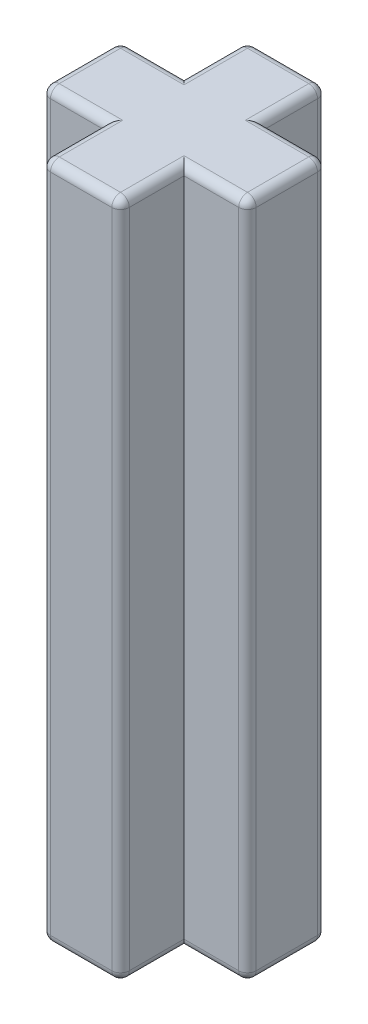
from build123d import *

# Parameters (mm, degrees)
BOSS_EXTRUDE1_DEPTH = 15.5
FILLET1_R           = 0.2
FILLET2_R           = 0.2
FILLET3_R           = 0.2


with BuildPart() as part:
    # Sketch1 → Boss-Extrude1 (new body)
    with BuildSketch(Plane(origin=(0, 0, 0), x_dir=(1, 0, 0), z_dir=(0, 1, 0))):
        Polygon((-0.9, 0.9), (-0.9, 2.35), (0.9, 2.35), (0.9, 0.9), (2.35, 0.9), (2.35, -0.9), (0.9, -0.9), (0.9, -2.35), (-0.9, -2.35), (-0.9, -0.9), (-2.35, -0.9), (-2.35, 0.9), align=None)
    extrude(amount=BOSS_EXTRUDE1_DEPTH)

    # Fillet1
    fillet1_edges = [part.edges().sort_by_distance(p)[0] for p in [
        (-0.9, 15.5, -1.625),
        (-1.625, 15.5, -0.9),
        (-2.35, 15.5, 0),
        (-1.625, 15.5, 0.9),
        (-0.9, 15.5, 1.625),
        (0, 15.5, 2.35),
        (0.9, 15.5, 1.625),
        (1.625, 15.5, 0.9),
        (2.35, 15.5, 0),
        (1.625, 15.5, -0.9),
        (0.9, 15.5, -1.625),
        (0, 15.5, -2.35),
    ]]
    fillet(fillet1_edges, radius=FILLET1_R)

    # Fillet2
    fillet2_edges = [part.edges().sort_by_distance(p)[0] for p in [
        (1.625, 0, -0.9),
        (2.35, 0, 0),
        (1.625, 0, 0.9),
        (0.9, 0, 1.625),
        (0, 0, 2.35),
        (-0.9, 0, 1.625),
        (-1.625, 0, 0.9),
        (-2.35, 0, 0),
        (-1.625, 0, -0.9),
        (-0.9, 0, -1.625),
        (0, 0, -2.35),
        (0.9, 0, -1.625),
    ]]
    fillet(fillet2_edges, radius=FILLET2_R)

    # Fillet3
    # the kernel refuses this fillet: 0.2 mm, written as the material it takes off along each edge
    with BuildSketch(Plane(origin=(-2.15, 15.3, 0.7), x_dir=(0, 0, 1), z_dir=(-1, 0, 0))) as fillet3_piece_1_section:
        Polygon((0, 0), (FILLET3_R, 0), (FILLET3_R, FILLET3_R), (0, FILLET3_R), align=None)
    fillet3_piece_1 = extrude(amount=FILLET3_R, mode=Mode.PRIVATE)
    fillet3_piece_1 = fillet3_piece_1 - Plane(origin=(-2.15, 15.3, 0.7), x_dir=(0, -0.7071067811865475, -0.7071067811865475), z_dir=(-1, 0, 0)) * Sphere(FILLET3_R, mode=Mode.PRIVATE)
    add(fillet3_piece_1, mode=Mode.SUBTRACT)
    with BuildSketch(Plane(origin=(-0.7, 15.3, 2.15), x_dir=(0, 0, 1), z_dir=(-1, 0, 0))) as fillet3_piece_2_section:
        Polygon((0, 0), (FILLET3_R, 0), (FILLET3_R, FILLET3_R), (0, FILLET3_R), align=None)
    fillet3_piece_2 = extrude(amount=FILLET3_R, mode=Mode.PRIVATE)
    fillet3_piece_2 = fillet3_piece_2 - Plane(origin=(-0.7, 15.3, 2.15), x_dir=(0, -0.7071067811865475, -0.7071067811865475), z_dir=(-1, 0, 0)) * Sphere(FILLET3_R, mode=Mode.PRIVATE)
    add(fillet3_piece_2, mode=Mode.SUBTRACT)
    with BuildSketch(Plane(origin=(-2.15, 15.3, -0.7), x_dir=(-1, 0, 0), z_dir=(0, 0, -1))) as fillet3_piece_3_section:
        Polygon((0, 0), (FILLET3_R, 0), (FILLET3_R, FILLET3_R), (0, FILLET3_R), align=None)
    fillet3_piece_3 = extrude(amount=FILLET3_R, mode=Mode.PRIVATE)
    fillet3_piece_3 = fillet3_piece_3 - Plane(origin=(-2.15, 15.3, -0.7), x_dir=(0.7071067811865475, -0.7071067811865475, 0), z_dir=(0, 0, -1)) * Sphere(FILLET3_R, mode=Mode.PRIVATE)
    add(fillet3_piece_3, mode=Mode.SUBTRACT)
    with BuildSketch(Plane(origin=(0.7, 15.3, 2.15), x_dir=(0, 0, 1), z_dir=(1, 0, 0))) as fillet3_piece_4_section:
        Polygon((0, 0), (FILLET3_R, 0), (FILLET3_R, -FILLET3_R), (0, -FILLET3_R), align=None)
    fillet3_piece_4 = extrude(amount=FILLET3_R, mode=Mode.PRIVATE)
    fillet3_piece_4 = fillet3_piece_4 - Plane(origin=(0.7, 15.3, 2.15), x_dir=(0, -0.7071067811865475, -0.7071067811865475), z_dir=(1, 0, 0)) * Sphere(FILLET3_R, mode=Mode.PRIVATE)
    add(fillet3_piece_4, mode=Mode.SUBTRACT)
    with BuildSketch(Plane(origin=(-0.7, 15.3, -2.15), x_dir=(0, 0, -1), z_dir=(-1, 0, 0))) as fillet3_piece_5_section:
        Polygon((0, 0), (FILLET3_R, 0), (FILLET3_R, -FILLET3_R), (0, -FILLET3_R), align=None)
    fillet3_piece_5 = extrude(amount=FILLET3_R, mode=Mode.PRIVATE)
    fillet3_piece_5 = fillet3_piece_5 - Plane(origin=(-0.7, 15.3, -2.15), x_dir=(0, -0.7071067811865475, 0.7071067811865475), z_dir=(-1, 0, 0)) * Sphere(FILLET3_R, mode=Mode.PRIVATE)
    add(fillet3_piece_5, mode=Mode.SUBTRACT)
    with BuildSketch(Plane(origin=(2.15, 15.3, 0.7), x_dir=(0, 0, 1), z_dir=(1, 0, 0))) as fillet3_piece_6_section:
        Polygon((0, 0), (FILLET3_R, 0), (FILLET3_R, -FILLET3_R), (0, -FILLET3_R), align=None)
    fillet3_piece_6 = extrude(amount=FILLET3_R, mode=Mode.PRIVATE)
    fillet3_piece_6 = fillet3_piece_6 - Plane(origin=(2.15, 15.3, 0.7), x_dir=(0, -0.7071067811865475, -0.7071067811865475), z_dir=(1, 0, 0)) * Sphere(FILLET3_R, mode=Mode.PRIVATE)
    add(fillet3_piece_6, mode=Mode.SUBTRACT)
    with BuildSketch(Plane(origin=(0.7, 15.3, -2.15), x_dir=(1, 0, 0), z_dir=(0, 0, -1))) as fillet3_piece_7_section:
        Polygon((0, 0), (FILLET3_R, 0), (FILLET3_R, -FILLET3_R), (0, -FILLET3_R), align=None)
    fillet3_piece_7 = extrude(amount=FILLET3_R, mode=Mode.PRIVATE)
    fillet3_piece_7 = fillet3_piece_7 - Plane(origin=(0.7, 15.3, -2.15), x_dir=(-0.7071067811865475, -0.7071067811865475, 0), z_dir=(0, 0, -1)) * Sphere(FILLET3_R, mode=Mode.PRIVATE)
    add(fillet3_piece_7, mode=Mode.SUBTRACT)
    with BuildSketch(Plane(origin=(2.15, 15.3, -0.7), x_dir=(1, 0, 0), z_dir=(0, 0, -1))) as fillet3_piece_8_section:
        Polygon((0, 0), (FILLET3_R, 0), (FILLET3_R, -FILLET3_R), (0, -FILLET3_R), align=None)
    fillet3_piece_8 = extrude(amount=FILLET3_R, mode=Mode.PRIVATE)
    fillet3_piece_8 = fillet3_piece_8 - Plane(origin=(2.15, 15.3, -0.7), x_dir=(-0.7071067811865475, -0.7071067811865475, 0), z_dir=(0, 0, -1)) * Sphere(FILLET3_R, mode=Mode.PRIVATE)
    add(fillet3_piece_8, mode=Mode.SUBTRACT)
    with BuildSketch(Plane(origin=(0.7, 0.2, 2.15), x_dir=(0, 0, 1), z_dir=(1, 0, 0))) as fillet3_piece_9_section:
        Polygon((0, 0), (FILLET3_R, 0), (FILLET3_R, FILLET3_R), (0, FILLET3_R), align=None)
    fillet3_piece_9 = extrude(amount=FILLET3_R, mode=Mode.PRIVATE)
    fillet3_piece_9 = fillet3_piece_9 - Plane(origin=(0.7, 0.2, 2.15), x_dir=(0, 0.7071067811865475, -0.7071067811865475), z_dir=(1, 0, 0)) * Sphere(FILLET3_R, mode=Mode.PRIVATE)
    add(fillet3_piece_9, mode=Mode.SUBTRACT)
    with BuildSketch(Plane(origin=(-0.7, 0.2, 2.15), x_dir=(0, 0, 1), z_dir=(-1, 0, 0))) as fillet3_piece_10_section:
        Polygon((0, 0), (FILLET3_R, 0), (FILLET3_R, -FILLET3_R), (0, -FILLET3_R), align=None)
    fillet3_piece_10 = extrude(amount=FILLET3_R, mode=Mode.PRIVATE)
    fillet3_piece_10 = fillet3_piece_10 - Plane(origin=(-0.7, 0.2, 2.15), x_dir=(0, 0.7071067811865475, -0.7071067811865475), z_dir=(-1, 0, 0)) * Sphere(FILLET3_R, mode=Mode.PRIVATE)
    add(fillet3_piece_10, mode=Mode.SUBTRACT)
    with BuildSketch(Plane(origin=(2.15, 0.2, 0.7), x_dir=(0, 0, 1), z_dir=(1, 0, 0))) as fillet3_piece_11_section:
        Polygon((0, 0), (FILLET3_R, 0), (FILLET3_R, FILLET3_R), (0, FILLET3_R), align=None)
    fillet3_piece_11 = extrude(amount=FILLET3_R, mode=Mode.PRIVATE)
    fillet3_piece_11 = fillet3_piece_11 - Plane(origin=(2.15, 0.2, 0.7), x_dir=(0, 0.7071067811865475, -0.7071067811865475), z_dir=(1, 0, 0)) * Sphere(FILLET3_R, mode=Mode.PRIVATE)
    add(fillet3_piece_11, mode=Mode.SUBTRACT)
    with BuildSketch(Plane(origin=(-2.15, 0.2, 0.7), x_dir=(0, 0, 1), z_dir=(-1, 0, 0))) as fillet3_piece_12_section:
        Polygon((0, 0), (FILLET3_R, 0), (FILLET3_R, -FILLET3_R), (0, -FILLET3_R), align=None)
    fillet3_piece_12 = extrude(amount=FILLET3_R, mode=Mode.PRIVATE)
    fillet3_piece_12 = fillet3_piece_12 - Plane(origin=(-2.15, 0.2, 0.7), x_dir=(0, 0.7071067811865475, -0.7071067811865475), z_dir=(-1, 0, 0)) * Sphere(FILLET3_R, mode=Mode.PRIVATE)
    add(fillet3_piece_12, mode=Mode.SUBTRACT)
    with BuildSketch(Plane(origin=(2.15, 0.2, -0.7), x_dir=(1, 0, 0), z_dir=(0, 0, -1))) as fillet3_piece_13_section:
        Polygon((0, 0), (FILLET3_R, 0), (FILLET3_R, FILLET3_R), (0, FILLET3_R), align=None)
    fillet3_piece_13 = extrude(amount=FILLET3_R, mode=Mode.PRIVATE)
    fillet3_piece_13 = fillet3_piece_13 - Plane(origin=(2.15, 0.2, -0.7), x_dir=(-0.7071067811865475, 0.7071067811865475, 0), z_dir=(0, 0, -1)) * Sphere(FILLET3_R, mode=Mode.PRIVATE)
    add(fillet3_piece_13, mode=Mode.SUBTRACT)
    with BuildSketch(Plane(origin=(-2.15, 0.2, -0.7), x_dir=(-1, 0, 0), z_dir=(0, 0, -1))) as fillet3_piece_14_section:
        Polygon((0, 0), (FILLET3_R, 0), (FILLET3_R, -FILLET3_R), (0, -FILLET3_R), align=None)
    fillet3_piece_14 = extrude(amount=FILLET3_R, mode=Mode.PRIVATE)
    fillet3_piece_14 = fillet3_piece_14 - Plane(origin=(-2.15, 0.2, -0.7), x_dir=(0.7071067811865475, 0.7071067811865475, 0), z_dir=(0, 0, -1)) * Sphere(FILLET3_R, mode=Mode.PRIVATE)
    add(fillet3_piece_14, mode=Mode.SUBTRACT)
    with BuildSketch(Plane(origin=(0.7, 0.2, -2.15), x_dir=(1, 0, 0), z_dir=(0, 0, -1))) as fillet3_piece_15_section:
        Polygon((0, 0), (FILLET3_R, 0), (FILLET3_R, FILLET3_R), (0, FILLET3_R), align=None)
    fillet3_piece_15 = extrude(amount=FILLET3_R, mode=Mode.PRIVATE)
    fillet3_piece_15 = fillet3_piece_15 - Plane(origin=(0.7, 0.2, -2.15), x_dir=(-0.7071067811865475, 0.7071067811865475, 0), z_dir=(0, 0, -1)) * Sphere(FILLET3_R, mode=Mode.PRIVATE)
    add(fillet3_piece_15, mode=Mode.SUBTRACT)
    with BuildSketch(Plane(origin=(-0.7, 0.2, -2.15), x_dir=(0, 0, -1), z_dir=(-1, 0, 0))) as fillet3_piece_16_section:
        Polygon((0, 0), (FILLET3_R, 0), (FILLET3_R, FILLET3_R), (0, FILLET3_R), align=None)
    fillet3_piece_16 = extrude(amount=FILLET3_R, mode=Mode.PRIVATE)
    fillet3_piece_16 = fillet3_piece_16 - Plane(origin=(-0.7, 0.2, -2.15), x_dir=(0, 0.7071067811865475, 0.7071067811865475), z_dir=(-1, 0, 0)) * Sphere(FILLET3_R, mode=Mode.PRIVATE)
    add(fillet3_piece_16, mode=Mode.SUBTRACT)
    with BuildSketch(Plane(origin=(2.35, 0.2, -0.9), x_dir=(-1, 0, 0), z_dir=(0, 1, 0)), Plane(origin=(2.35, 0.2, 0.9), x_dir=(0, 0, -1), z_dir=(0, 1, 0)), Plane(origin=(0.9, 0.2, 2.35), x_dir=(0, 0, -1), z_dir=(0, 1, 0)), Plane(origin=(-0.9, 0.2, -2.35), x_dir=(0, 0, 1), z_dir=(0, 1, 0)), Plane(origin=(0.9, 0.2, -2.35), x_dir=(-1, 0, 0), z_dir=(0, 1, 0))) as fillet3_piece_17:
        with BuildLine():
            CenterArc((FILLET3_R, FILLET3_R), FILLET3_R, 180, 90)
            Line((0, FILLET3_R), (0, 0))
            Line((0, 0), (FILLET3_R, 0))
        make_face()
    extrude(amount=15.1, mode=Mode.SUBTRACT)
    with BuildSketch(Plane(origin=(-0.9, 0.2, 2.35), x_dir=(0, 0, -1), z_dir=(0, 1, 0)), Plane(origin=(-2.35, 0.2, 0.9), x_dir=(0, 0, -1), z_dir=(0, 1, 0)), Plane(origin=(-2.35, 0.2, -0.9), x_dir=(1, 0, 0), z_dir=(0, 1, 0))) as fillet3_piece_18:
        with BuildLine():
            CenterArc((FILLET3_R, -FILLET3_R), FILLET3_R, 90, 90)
            Line((0, -FILLET3_R), (0, 0))
            Line((0, 0), (FILLET3_R, 0))
        make_face()
    extrude(amount=15.1, mode=Mode.SUBTRACT)


solid = part.part
